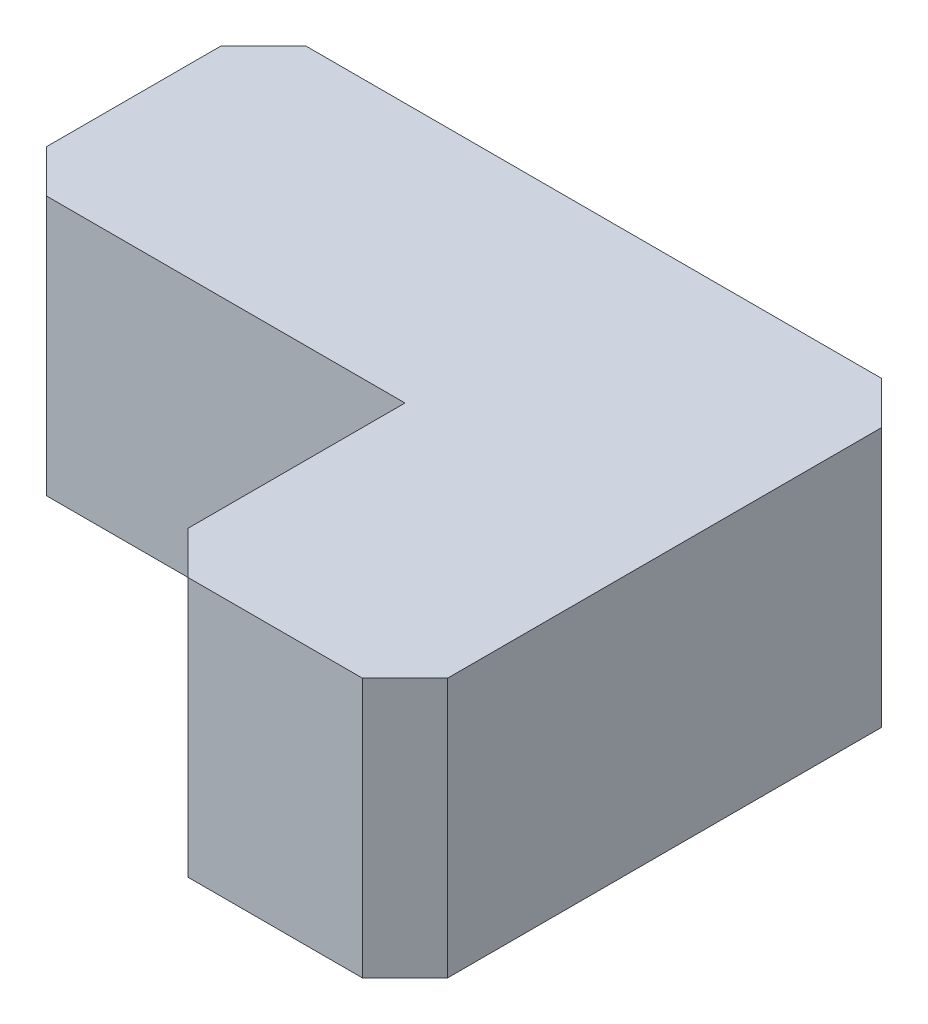
from build123d import *

# Parameters (mm, degrees)
BOSS_EXTRUDE1_DEPTH = 55
SHELL1_START        = 3
SHELL1_DEPTH        = 49


# Read off the part's stored shape, not the designer's step: Shell1
with BuildPart() as part:
    # Sketch2 → Boss-Extrude1 (new body)
    with BuildSketch(Plane(origin=(0, 0, 0), x_dir=(1, 0, 0), z_dir=(0, 1, 0))):
        Polygon((9, 55), (0, 46), (0, 9), (9, 0), (85, 0), (140, 0), (140, 46), (131, 55), align=None)
        Polygon((140, 0), (85, 0), (85, -46), (94, -55), (131, -55), (140, -46), align=None)
    extrude(amount=BOSS_EXTRUDE1_DEPTH)

    # Shell1 outline → Shell1 (cut)
    with BuildSketch(Plane(origin=(0, 0, 0), x_dir=(1, 0, 0), z_dir=(0, 1, 0)).offset(SHELL1_START)):
        Polygon((10.242640687, 3), (88, 3), (88, -44.757359313), (95.242640687, -52), (129.757359313, -52), (137, -44.757359313), (137, 44.757359313), (129.757359313, 52), (10.242640687, 52), (3, 44.757359313), (3, 10.242640687), align=None)
    extrude(amount=SHELL1_DEPTH, mode=Mode.SUBTRACT)


solid = part.part
